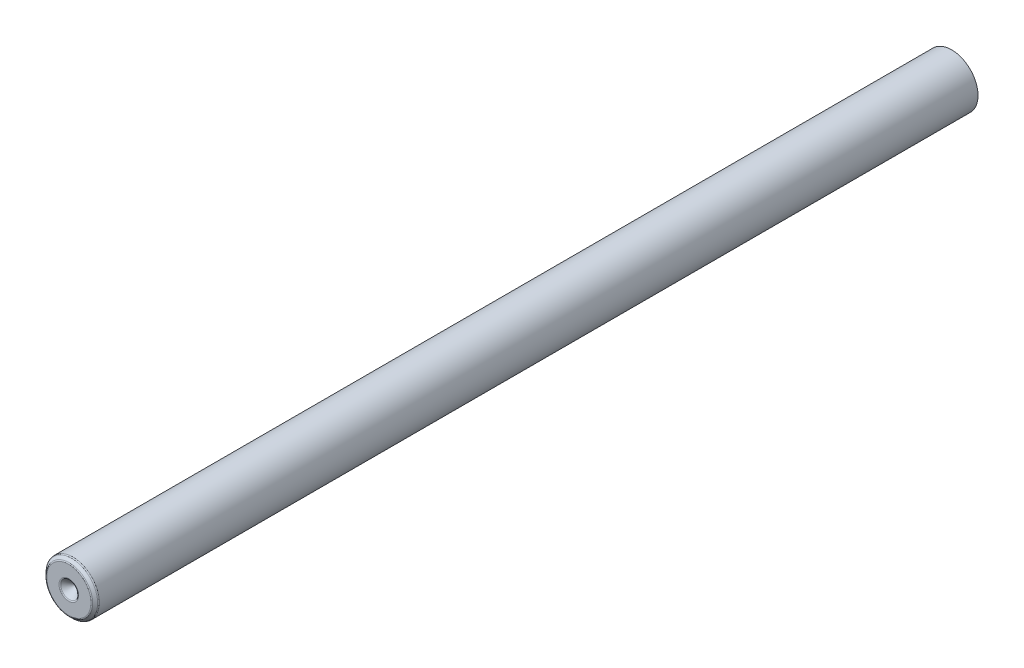
from build123d import *

# Parameters (mm, degrees)
SKETCH1_R           = 15
BOSS_EXTRUDE1_DEPTH = 503
CHAMFER1_SIZE       = 2
SKETCH2_R           = 5.177936305
CUT_EXTRUDE1_DEPTH  = 5
CHAMFER2_SIZE       = 5


with BuildPart() as part:
    # Sketch1 → Boss-Extrude1 (new body)
    with BuildSketch(Plane.XY):
        Circle(SKETCH1_R)
    extrude(amount=BOSS_EXTRUDE1_DEPTH)

    # Chamfer1
    chamfer1_edges = [part.edges().sort_by_distance(p)[0] for p in [
        (-15, 0, 503),
    ]]
    chamfer(chamfer1_edges, length=CHAMFER1_SIZE)

    # Sketch2 → Cut-Extrude1 (cut)
    with BuildSketch(Plane.XY.offset(503)):
        Circle(SKETCH2_R)
    extrude(amount=-CUT_EXTRUDE1_DEPTH, mode=Mode.SUBTRACT)

    # Chamfer2
    chamfer2_edges = [part.edges().sort_by_distance(p)[0] for p in [
        (-5.177936305, 0, 498),
    ]]
    chamfer(chamfer2_edges, length=CHAMFER2_SIZE - 0.0001)  # a hair under: the kernel refuses the full size

    # Fillet1: read off the stored shape, not the designer's step
    # Fillet1 outline → Fillet1 (revolve, cut)
    with BuildSketch(Plane.XZ):
        with BuildLine():
            ThreePointArc((14.707106781, 501.292893219), (14.923879533, 500.96846987), (15, 500.585786438))
            Line((15, 500.585786438), (15, 501.292893219))
            Line((15, 501.292893219), (14.707106781, 501.292893219))
        make_face()
        with BuildLine():
            ThreePointArc((12.585786438, 503), (12.96846987, 502.923879533), (13.292893219, 502.707106781))
            Line((13.292893219, 502.707106781), (13.292893219, 503))
            Line((13.292893219, 503), (12.585786438, 503))
        make_face()
        with BuildLine():
            ThreePointArc((4.885043086, 502.707106781), (5.209466435, 502.923879533), (5.592149867, 503))
            Line((5.592149867, 503), (4.885043086, 503))
            Line((4.885043086, 503), (4.885043086, 502.707106781))
        make_face()
    revolve(axis=Axis((0, 0, 0), (0, 0, 1)), mode=Mode.SUBTRACT)


solid = part.part
